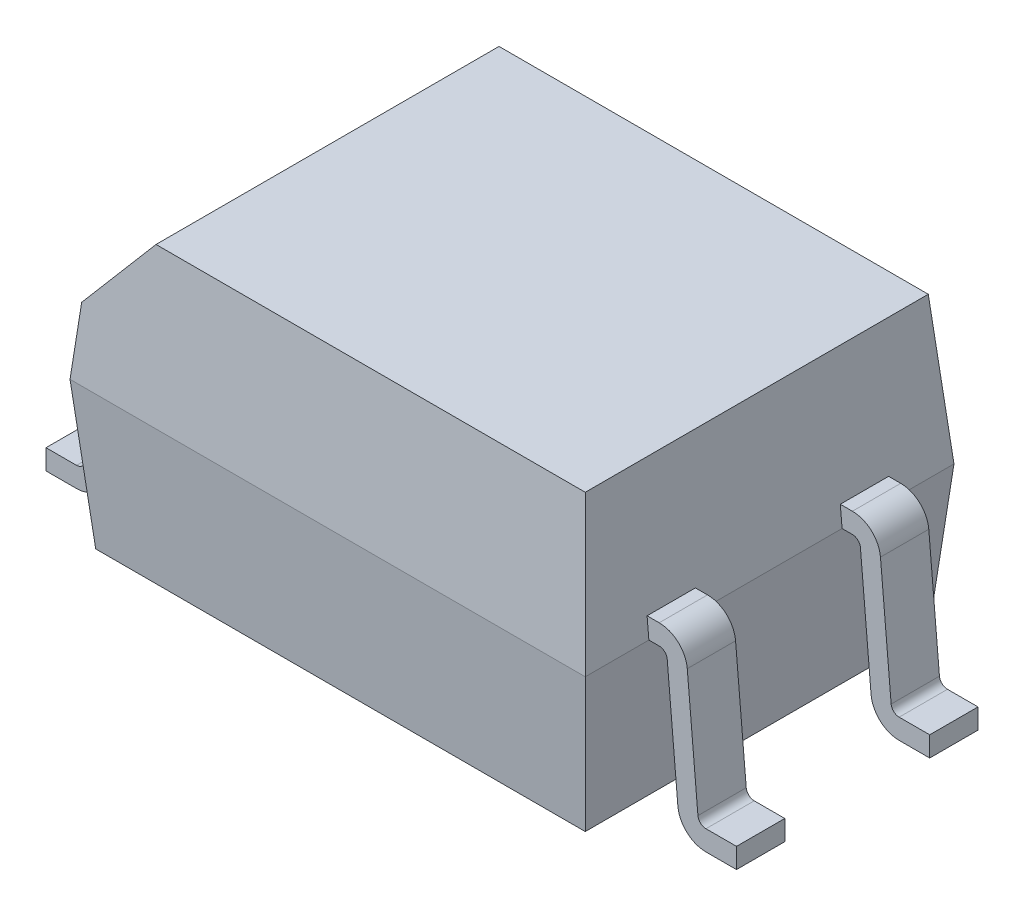
from build123d import *

# Parameters (mm, degrees)
SKETCH1_W                = 6.4
SKETCH1_H                = 4.58
EXTRUDE1_DEPTH           = 1.825
EXTRUDE1_TAPER           = 5
EXTRUDE1_OTHER_WAY_DEPTH = 1.825
EXTRUDE1_OTHER_WAY_TAPER = 5
CHAMFER1_SIZE            = 1
CHAMFER1_SIZE_2          = 0.748750861
EXTRUDE2_START           = 1.2
EXTRUDE2_DEPTH           = 0.3
FILLET1_R                = 0.1
FILLET2_R                = 0.35


with BuildPart() as part:
    # Sketch1 → Extrude1 (new body)
    with BuildSketch(Plane(origin=(0, 0, 0), x_dir=(1, 0, 0), z_dir=(0, 1, 0))):
        Rectangle(SKETCH1_W, SKETCH1_H)
    extrude(amount=EXTRUDE1_DEPTH, taper=EXTRUDE1_TAPER)

    # Sketch1 → Extrude1 other way (add)
    with BuildSketch(Plane(origin=(0, 0, 0), x_dir=(1, 0, 0), z_dir=(0, 1, 0))):
        Rectangle(SKETCH1_W, SKETCH1_H)
    extrude(amount=-EXTRUDE1_OTHER_WAY_DEPTH, taper=EXTRUDE1_OTHER_WAY_TAPER)

    # Chamfer1
    # the kernel refuses this chamfer: 1, 0.748750861 mm, written as the material it takes off along each edge
    with BuildSketch(Plane(origin=(-3.040333189, 1.825, -4.712885419), x_dir=(-0.10925940413866445, -0.9940132708406181, 0), z_dir=(0, 0, 1))) as chamfer1_piece_1:
        Polygon((CHAMFER1_SIZE * 0.999753334764, CHAMFER1_SIZE * 0.0222096741985), (-CHAMFER1_SIZE_2 * 0.109259404139, CHAMFER1_SIZE_2 * 0.994013270843), (0, 0), align=None)
    extrude(amount=9.425770839, mode=Mode.SUBTRACT)

    # Sketch2 → Extrude2 (add, symmetric)
    with BuildSketch(Plane.XY.offset(EXTRUDE2_START)):
        Polygon((-2.92973568, 0), (-3.42, 0), (-3.588415677, -1.925), (-4.288415677, -1.925), (-4.288415677, -1.675), (-3.817498471, -1.675), (-3.649082794, 0.25), (-2.92973568, 0.25), align=None)
        Polygon((2.92973568, 0.25), (2.92973568, 0), (3.42, 0), (3.588415677, -1.925), (4.288415677, -1.925), (4.288415677, -1.675), (3.817498471, -1.675), (3.649082794, 0.25), align=None)
    extrude2 = extrude(amount=EXTRUDE2_DEPTH, both=True)

    # Mirror1: Extrude2 across plane
    add(extrude2.mirror(Plane.XY))

    # Fillet1
    fillet1_edges = [part.edges().sort_by_distance(p)[0] for p in [
        (3.817498471, -1.675, -1.2),
        (3.42, 0, -1.2),
        (-3.817498471, -1.675, 1.2),
        (-3.42, 0, 1.2),
        (3.42, 0, 1.2),
        (3.817498471, -1.675, 1.2),
        (-3.42, 0, -1.2),
        (-3.817498471, -1.675, -1.2),
    ]]
    fillet(fillet1_edges, radius=FILLET1_R)

    # Fillet2
    fillet2_edges = [part.edges().sort_by_distance(p)[0] for p in [
        (3.649082794, 0.25, -1.2),
        (3.588415677, -1.925, -1.2),
        (-3.649082794, 0.25, 1.2),
        (-3.588415677, -1.925, 1.2),
        (3.649082794, 0.25, 1.2),
        (3.588415677, -1.925, 1.2),
        (-3.649082794, 0.25, -1.2),
        (-3.588415677, -1.925, -1.2),
    ]]
    fillet(fillet2_edges, radius=FILLET2_R)


solid = part.part
